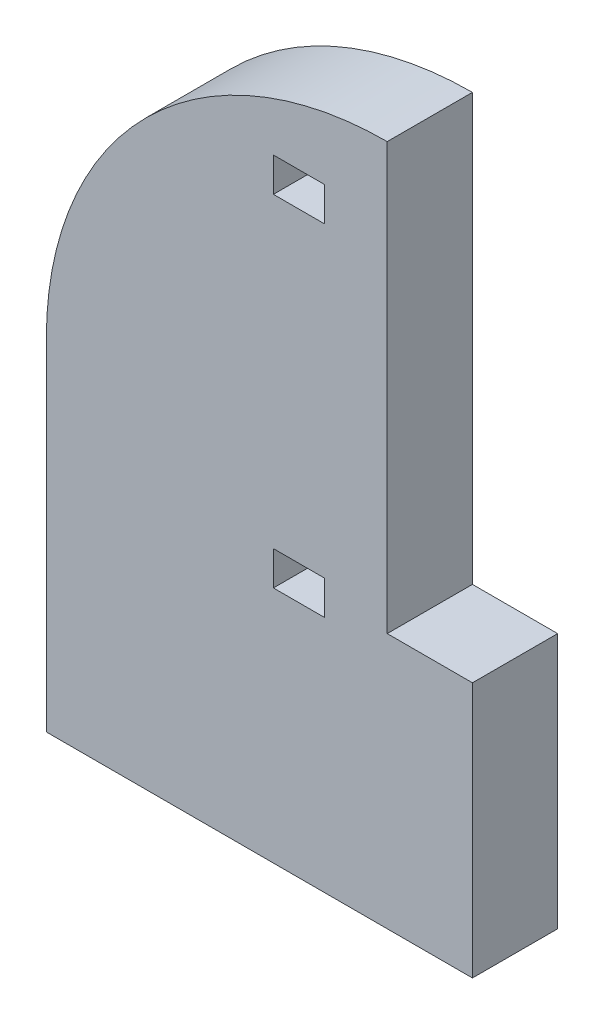
from build123d import *

# Parameters (mm, degrees)
SKETCH1_W           = 3
SKETCH1_H           = 2
BOSS_EXTRUDE1_DEPTH = 5


with BuildPart() as part:
    # Sketch1 → Boss-Extrude1 (new body)
    with BuildSketch(Plane.XY):
        with BuildLine():
            Line((10, -20), (-10, -20))
            Line((-10, -20), (-10, 0))
            ThreePointArc((-10, 0), (-4.142135624, 14.142135624), (10, 20))
            Line((10, 20), (10, -5))
            Line((10, -5), (15, -5))
            Line((15, -5), (15, -20))
            Line((15, -20), (10, -20))
        make_face()
        with Locations((4.821732665, -5.020380906)):
            Rectangle(SKETCH1_W, SKETCH1_H, mode=Mode.SUBTRACT)
        with Locations((4.821732665, 14.979619094)):
            Rectangle(SKETCH1_W, SKETCH1_H, mode=Mode.SUBTRACT)
    extrude(amount=BOSS_EXTRUDE1_DEPTH)


solid = part.part
